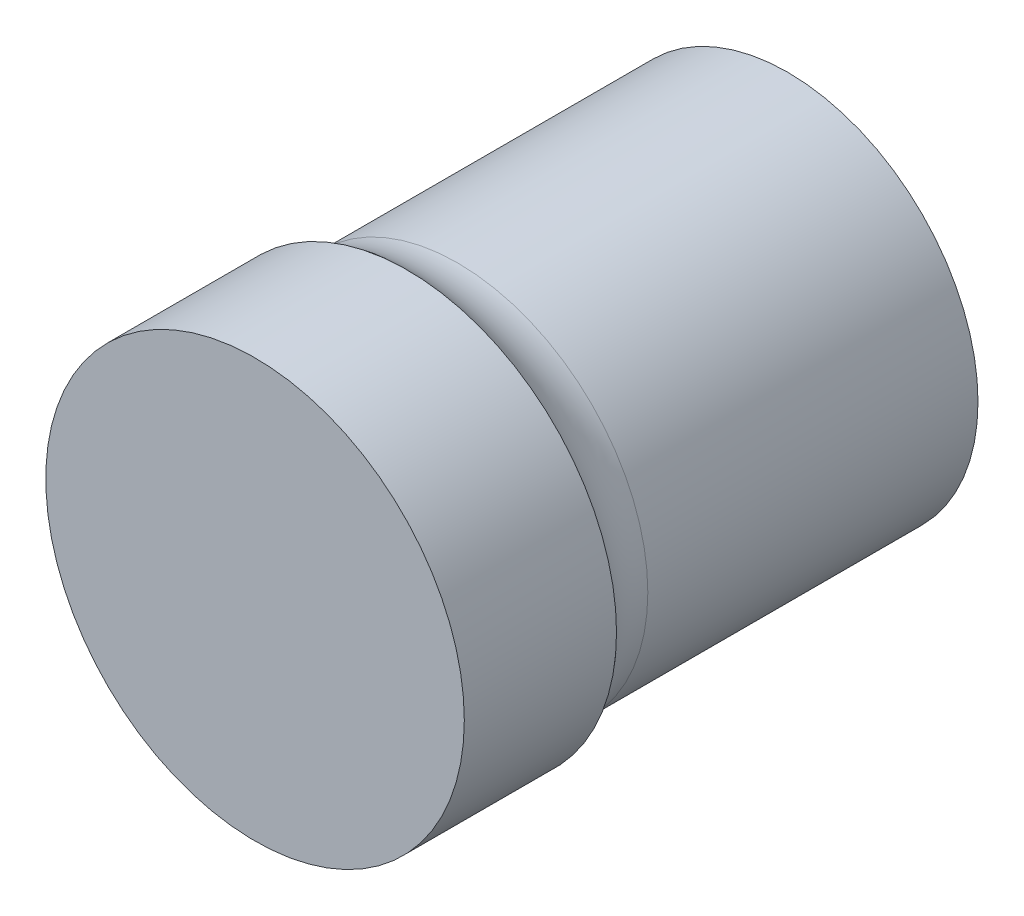
from build123d import *

# Parameters (mm, degrees)
SCHIZZO1_R                   = 2.5
SCHIZZO1_R_2                 = 1.5
ESTRUSIONE_ESTRUSIONE1_DEPTH = 5
SCHIZZO2_R                   = 2.75
ESTRUSIONE_ESTRUSIONE2_DEPTH = 2
RACCORDO1_R                  = 1


with BuildPart() as part:
    # Schizzo1 → Estrusione-Estrusione1 (new body)
    with BuildSketch(Plane.XY):
        Circle(SCHIZZO1_R)
        Circle(SCHIZZO1_R_2, mode=Mode.SUBTRACT)
    extrude(amount=ESTRUSIONE_ESTRUSIONE1_DEPTH)

    # Schizzo2 → Estrusione-Estrusione2 (add)
    with BuildSketch(Plane.XY.offset(5)):
        Circle(SCHIZZO2_R)
    extrude(amount=ESTRUSIONE_ESTRUSIONE2_DEPTH)

    # Raccordo1
    # the kernel refuses this fillet: 1 mm, written as the material it adds along each edge
    with BuildSketch(Plane(origin=(0, 0, 5), x_dir=(1, 0, 0), z_dir=(0, -1, 0))) as raccordo1_piece_1:
        with BuildLine():
            CenterArc((3.5, -0.661437828), RACCORDO1_R, 138.590377891, 41.409622109)
            Line((2.5, -0.661437828), (2.48, -0.661437828))
            Line((2.48, -0.661437828), (2.48, 0))
            Line((2.48, 0), (2.5, 0.02))
            ThreePointArc((2.5, 0.02), (2.625, 0.02), (2.735, 0.013228757))
            Line((2.735, 0.013228757), (2.75, 0))
        make_face()
    revolve(axis=Axis((0, 0, 5), (0, 0, 1)))


solid = part.part
